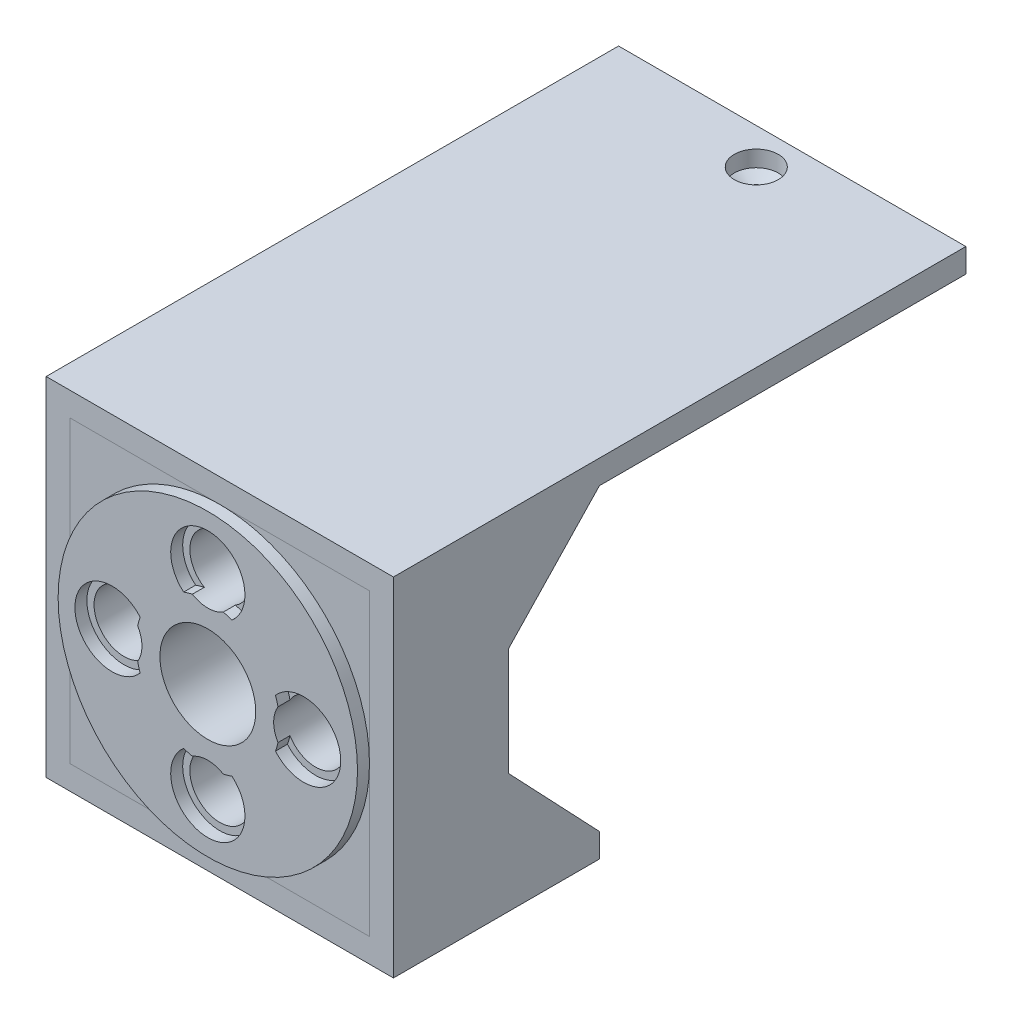
from build123d import *

# Parameters (mm, degrees)
SKETCH_3_R          = 12.5
SKETCH_3_R_2        = 4
SKETCH_3_R_3        = 2.5
EXTRUDE_2_DEPTH     = 7.8
CUT_EXTRUDE_1_DEPTH = 1
CUT_EXTRUDE_START   = -6.8
CUT_EXTRUDE_2_DEPTH = 1
EXTRUDE_START       = -7.8
SKETCH_3_6_R        = 12.5
EXTRUDE_3_DEPTH     = 2.8
EXTRUDE_START_2     = -1
EXTRUDE_4_DEPTH     = 8
EXTRUDE_4_2_DEPTH   = 8
EXTRUDE_4_3_DEPTH   = 8
EXTRUDE_4_4_DEPTH   = 8
EXTRUDE_6_DEPTH     = 17.2
EXTRUDE_START_3     = -18.2
EXTRUDE_13_DEPTH    = 30.6
CUT_EXTRUDE_3_DEPTH = 59.58916282
CUT_EXTRUDE_START_2 = -3.6
CUT_EXTRUDE_4_DEPTH = 3.6


with BuildPart() as part:
    # 草图3 → 凸台-拉伸2 (new body)
    with BuildSketch(Plane.XY):
        Circle(SKETCH_3_R)
        Circle(SKETCH_3_R_2, mode=Mode.SUBTRACT)
        with Locations((0, 8)):
            Circle(SKETCH_3_R_3, mode=Mode.SUBTRACT)
        with Locations((8, 0)):
            Circle(SKETCH_3_R_3, mode=Mode.SUBTRACT)
        with Locations((0, -8)):
            Circle(SKETCH_3_R_3, mode=Mode.SUBTRACT)
        with Locations((-8, 0)):
            Circle(SKETCH_3_R_3, mode=Mode.SUBTRACT)
    extrude(amount=-EXTRUDE_2_DEPTH)

    # 草图3<3> → 切除-拉伸1 (cut)
    with BuildSketch(Plane.XY):
        with BuildLine():
            ThreePointArc((2.021029963, 5.649375), (0, 11.1), (-2.021029963, 5.649375))
            ThreePointArc((-2.021029963, 5.649375), (-1.659542073, 5.765927515), (-1.291404123, 5.859375))
            ThreePointArc((-1.291404123, 5.859375), (0, 10.5), (1.291404123, 5.859375))
            ThreePointArc((1.291404123, 5.859375), (1.659542073, 5.765927515), (2.021029963, 5.649375))
        make_face()
        with BuildLine():
            ThreePointArc((-5.859375, 1.291404123), (-5.765927515, 1.659542073), (-5.649375, 2.021029963))
            ThreePointArc((-5.649375, 2.021029963), (-11.1, 0), (-5.649375, -2.021029963))
            ThreePointArc((-5.649375, -2.021029963), (-5.765927515, -1.659542073), (-5.859375, -1.291404123))
            ThreePointArc((-5.859375, -1.291404123), (-10.5, 0), (-5.859375, 1.291404123))
        make_face()
        with BuildLine():
            ThreePointArc((5.649375, -2.021029963), (11.1, 0), (5.649375, 2.021029963))
            ThreePointArc((5.649375, 2.021029963), (5.765927515, 1.659542073), (5.859375, 1.291404123))
            ThreePointArc((5.859375, 1.291404123), (10.5, 0), (5.859375, -1.291404123))
            ThreePointArc((5.859375, -1.291404123), (5.765927515, -1.659542073), (5.649375, -2.021029963))
        make_face()
        with BuildLine():
            ThreePointArc((-1.291404123, -5.859375), (-1.659542073, -5.765927515), (-2.021029963, -5.649375))
            ThreePointArc((-2.021029963, -5.649375), (0, -11.1), (2.021029963, -5.649375))
            ThreePointArc((2.021029963, -5.649375), (1.659542073, -5.765927515), (1.291404123, -5.859375))
            ThreePointArc((1.291404123, -5.859375), (0, -10.5), (-1.291404123, -5.859375))
        make_face()
    extrude(amount=-CUT_EXTRUDE_1_DEPTH, mode=Mode.SUBTRACT)

    # 草图3<4> → 切除-拉伸2 (cut)
    with BuildSketch(Plane.XY.offset(CUT_EXTRUDE_START)):
        with BuildLine():
            ThreePointArc((2.021029963, 5.649375), (0, 11.1), (-2.021029963, 5.649375))
            ThreePointArc((-2.021029963, 5.649375), (-1.659542073, 5.765927515), (-1.291404123, 5.859375))
            ThreePointArc((-1.291404123, 5.859375), (0, 10.5), (1.291404123, 5.859375))
            ThreePointArc((1.291404123, 5.859375), (1.659542073, 5.765927515), (2.021029963, 5.649375))
        make_face()
        with BuildLine():
            ThreePointArc((-5.859375, 1.291404123), (-5.765927515, 1.659542073), (-5.649375, 2.021029963))
            ThreePointArc((-5.649375, 2.021029963), (-11.1, 0), (-5.649375, -2.021029963))
            ThreePointArc((-5.649375, -2.021029963), (-5.765927515, -1.659542073), (-5.859375, -1.291404123))
            ThreePointArc((-5.859375, -1.291404123), (-10.5, 0), (-5.859375, 1.291404123))
        make_face()
        with BuildLine():
            ThreePointArc((5.649375, -2.021029963), (11.1, 0), (5.649375, 2.021029963))
            ThreePointArc((5.649375, 2.021029963), (5.765927515, 1.659542073), (5.859375, 1.291404123))
            ThreePointArc((5.859375, 1.291404123), (10.5, 0), (5.859375, -1.291404123))
            ThreePointArc((5.859375, -1.291404123), (5.765927515, -1.659542073), (5.649375, -2.021029963))
        make_face()
        with BuildLine():
            ThreePointArc((-1.291404123, -5.859375), (-1.659542073, -5.765927515), (-2.021029963, -5.649375))
            ThreePointArc((-2.021029963, -5.649375), (0, -11.1), (2.021029963, -5.649375))
            ThreePointArc((2.021029963, -5.649375), (1.659542073, -5.765927515), (1.291404123, -5.859375))
            ThreePointArc((1.291404123, -5.859375), (0, -10.5), (-1.291404123, -5.859375))
        make_face()
    extrude(amount=-CUT_EXTRUDE_2_DEPTH, mode=Mode.SUBTRACT)

    # 草图3<6> → 凸台-拉伸3 (add)
    with BuildSketch(Plane.XY.offset(EXTRUDE_START)):
        Circle(SKETCH_3_6_R)
        with BuildLine():
            ThreePointArc((-2.021029963, 5.649375), (-1.293214429, 10.817374033), (3.1, 8))
            ThreePointArc((3.1, 8), (2.817374033, 6.706785571), (2.021029963, 5.649375))
            ThreePointArc((2.021029963, 5.649375), (4.242640687, 4.242640687), (5.649375, 2.021029963))
            ThreePointArc((5.649375, 2.021029963), (9.077743592, 2.906624976), (11.1, 0))
            ThreePointArc((11.1, 0), (9.077743592, -2.906624976), (5.649375, -2.021029963))
            ThreePointArc((5.649375, -2.021029963), (4.242640687, -4.242640687), (2.021029963, -5.649375))
            ThreePointArc((2.021029963, -5.649375), (2.817374033, -6.706785571), (3.1, -8))
            ThreePointArc((3.1, -8), (-1.293214429, -10.817374033), (-2.021029963, -5.649375))
            ThreePointArc((-2.021029963, -5.649375), (-4.242640687, -4.242640687), (-5.649375, -2.021029963))
            ThreePointArc((-5.649375, -2.021029963), (-11.1, 0), (-5.649375, 2.021029963))
            ThreePointArc((-5.649375, 2.021029963), (-4.242640687, 4.242640687), (-2.021029963, 5.649375))
        make_face(mode=Mode.SUBTRACT)
    extrude(amount=-EXTRUDE_3_DEPTH)


with BuildPart() as body_2:
    # 草图5 → 凸台-拉伸4 (new body)
    with BuildSketch(Plane.XY.offset(EXTRUDE_START_2)):
        with BuildLine():
            Line((12.5, -12.5), (12.5, 0))
            ThreePointArc((12.5, 0), (8.838834769, -8.838834761), (1.2e-08, -12.5))
            Line((1.2e-08, -12.5), (12.5, -12.5))
        make_face()
    extrude(amount=-EXTRUDE_4_DEPTH)


with BuildPart() as body_3:
    # 草图5 → Extrude 4 2 (new body)
    with BuildSketch(Plane.XY.offset(EXTRUDE_START_2)):
        with BuildLine():
            ThreePointArc((1.2e-08, -12.5), (-8.838834762, -8.838834768), (-12.5, 4e-09))
            Line((-12.5, 4e-09), (-12.5, -12.5))
            Line((-12.5, -12.5), (1.2e-08, -12.5))
        make_face()
    extrude(amount=-EXTRUDE_4_2_DEPTH)


with BuildPart() as body_4:
    # 草图5 → Extrude 4 3 (new body)
    with BuildSketch(Plane.XY.offset(EXTRUDE_START_2)):
        with BuildLine():
            Line((12.5, 12.5), (-1.7e-08, 12.5))
            ThreePointArc((-1.7e-08, 12.5), (8.838834759, 8.838834771), (12.5, 0))
            Line((12.5, 0), (12.5, 12.5))
        make_face()
    extrude(amount=-EXTRUDE_4_3_DEPTH)


with BuildPart() as body_5:
    # 草图5 → Extrude 4 4 (new body)
    with BuildSketch(Plane.XY.offset(EXTRUDE_START_2)):
        with BuildLine():
            Line((-1.7e-08, 12.5), (-12.5, 12.5))
            Line((-12.5, 12.5), (-12.5, 4e-09))
            ThreePointArc((-12.5, 4e-09), (-8.838834769, 8.83883476), (-1.7e-08, 12.5))
        make_face()
    extrude(amount=-EXTRUDE_4_4_DEPTH)


with BuildPart() as body_6:
    # 草图5<5> → 凸台-拉伸6 (new body)
    with BuildSketch(Plane.XY.offset(EXTRUDE_START_2)):
        Polygon((-12.5, 2.4e-08), (-12.5, 12.5), (-14.5, 12.5), (-14.5, -14.5), (14.5, -14.5), (14.5, 12.5), (12.5, 12.5), (12.5, 0), (12.5, -12.5), (2.4e-08, -12.5), (-12.5, -12.5), align=None)
        Polygon((-14.5, 12.5), (-12.5, 12.5), (0, 12.5), (12.5, 12.5), (14.5, 12.5), (14.5, 14.5), (-14.5, 14.5), align=None)
    extrude(amount=-EXTRUDE_6_DEPTH)

    # 草图5<7> → 凸台-拉伸13 (add)
    with BuildSketch(Plane.XY.offset(EXTRUDE_START_3)):
        Polygon((-14.5, 12.5), (-12.5, 12.5), (0, 12.5), (12.5, 12.5), (14.5, 12.5), (14.5, 14.5), (-14.5, 14.5), align=None)
    extrude(amount=-EXTRUDE_13_DEPTH)

    # 草图8 → 切除-拉伸3 (cut, through all)
    with BuildSketch(Plane.ZY.offset(14.5)):
        Polygon((-10.6, -4.5), (-10.6, 4.5), (-18.2, 12.5), (-18.2, -12.5), align=None)
    extrude(amount=-CUT_EXTRUDE_3_DEPTH, mode=Mode.SUBTRACT)

    # 草图9 → 切除-拉伸4 (cut)
    with BuildSketch(Plane.XZ.offset(14.5).offset(CUT_EXTRUDE_START_2)):
        Polygon((-14.5, -18.2), (14.5, -18.2), (4.5, -10.6), (-4.5, -10.6), align=None)
    extrude(amount=CUT_EXTRUDE_4_DEPTH, mode=Mode.SUBTRACT)

    # 草图10 → 孔1 (revolve, cut)
    with BuildSketch(Plane(origin=(0, 14.5, -45.8), x_dir=(0, 0, 1), z_dir=(1, 0, 0))):
        Polygon((0, 0), (0, 5.35), (0.9, 5.35), (0.9, 1.911804679), (1.835, 1.35), (1.835, 0), align=None)
    revolve(axis=Axis((0, 20.630023899, -45.8), (0, -1, 0)), mode=Mode.SUBTRACT)


solid = Compound([part.part, body_2.part, body_3.part, body_4.part, body_5.part, body_6.part])
